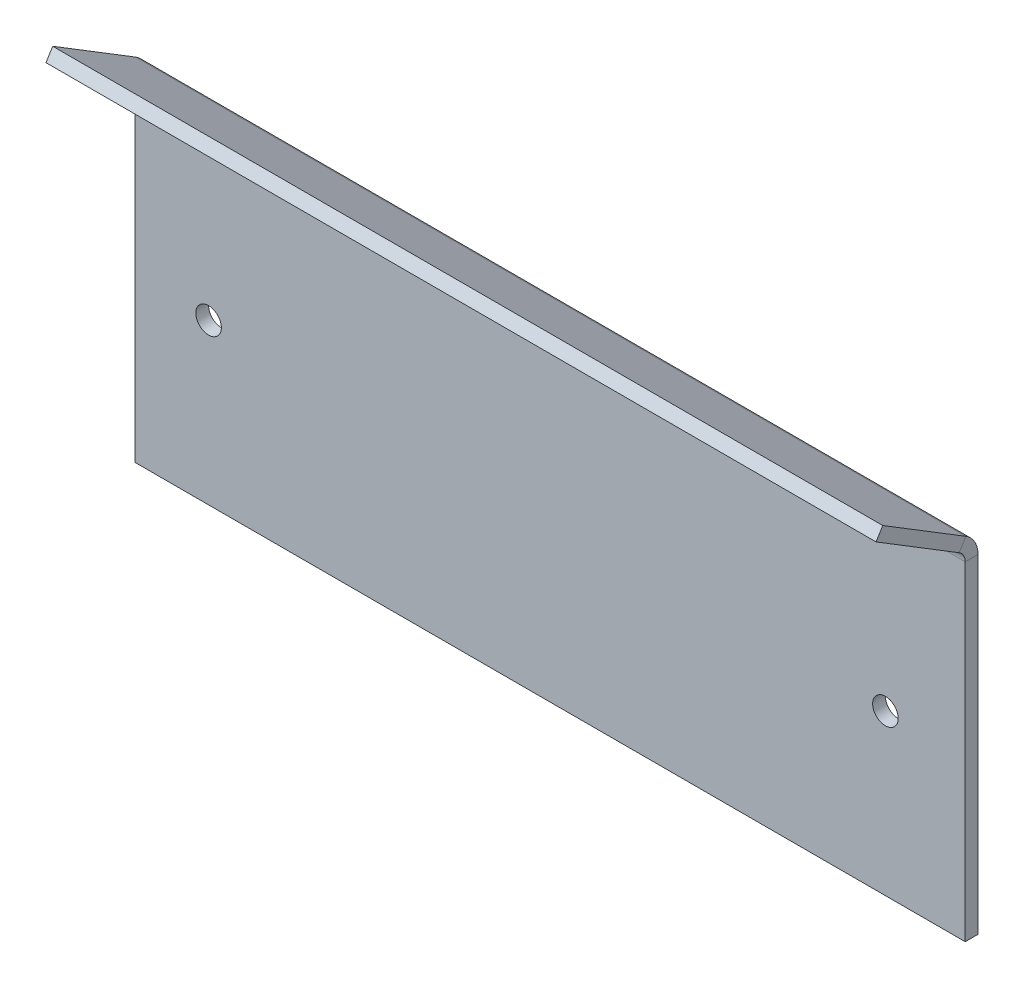
from build123d import *

# Parameters (mm, degrees)
SKETCH1_W            = 260
SKETCH1_H            = 110
BASE_FLANGE1_DEPTH   = 4
EDGE_FLANGE1_START   = -153.944751381
EDGE_FLANGE1_DEPTH   = 260
EDGE_FLANGE1_2_DEPTH = 260
SKETCH11_R           = 4
CUT_EXTRUDE1_DEPTH   = 177.112626118


# Read off the part's stored shape, not the designer's step: Edge-Flange1
# Sheet-metal steps are written as plain solids
with BuildPart() as part:
    # Sketch1 → Base-Flange1 (new body)
    with BuildSketch(Plane.XY):
        with Locations((-23.944751381, -24.35359116)):
            Rectangle(SKETCH1_W, SKETCH1_H)
    extrude(amount=-BASE_FLANGE1_DEPTH)

    # Edge-Flange1 outline → Edge-Flange1 (cut)
    with BuildSketch(Plane.YZ.offset(EDGE_FLANGE1_START)):
        with BuildLine():
            Line((30.64640884, 0), (30.536111734, -0.179988518))
            ThreePointArc((30.536111734, -0.179988518), (27.623960351, -2.979968057), (23.714990419, -4))
            Line((23.714990419, -4), (30.64640884, -4))
            Line((30.64640884, -4), (30.64640884, 0))
        make_face()
    extrude(amount=EDGE_FLANGE1_DEPTH, mode=Mode.SUBTRACT)

    # Edge-Flange1 2 outline → Edge-Flange1 2 (add)
    with BuildSketch(Plane.YZ.offset(EDGE_FLANGE1_START)):
        with BuildLine():
            Line((23.714990419, 0), (30.64640884, 0))
            Line((30.64640884, 0), (46.482655452, 25.842405752))
            Line((46.482655452, 25.842405752), (43.072094795, 27.932400011))
            Line((43.072094795, 27.932400011), (27.125551077, 1.910005741))
            ThreePointArc((27.125551077, 1.910005741), (25.669475385, 0.510015972), (23.714990419, 0))
        make_face()
    extrude(amount=EDGE_FLANGE1_2_DEPTH)

    # Sketch11 → Cut-Extrude1 (cut, through all)
    with BuildSketch(Plane(origin=(0, 0, -4), x_dir=(-1, 0, 0), z_dir=(0, 0, -1))):
        with Locations((-81.055248619, -29.285009581)):
            Circle(SKETCH11_R)
        with Locations((130.944751381, -29.285009581)):
            Circle(SKETCH11_R)
    extrude(amount=-CUT_EXTRUDE1_DEPTH, mode=Mode.SUBTRACT)


solid = part.part
